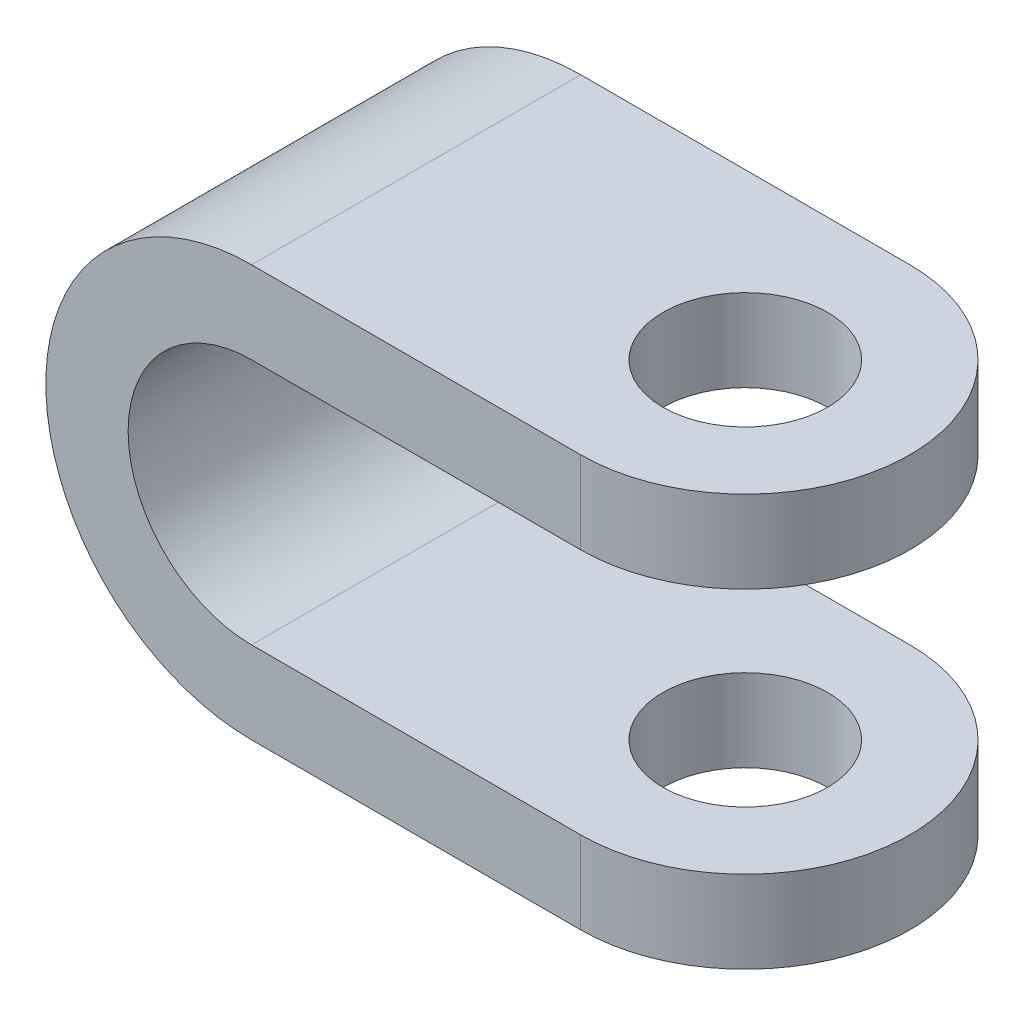
from build123d import *

# Parameters (mm, degrees)
EXTRUDE_THIN1_DEPTH = 90
SKETCH2_R           = 10
BOSS_EXTRUDE1_DEPTH = 90


with BuildPart() as part:
    # Sketch1 → Extrude-Thin1 (new body)
    with BuildSketch(Plane.XY):
        with BuildLine():
            Line((0, -15), (-60, -15))
            ThreePointArc((-60, -15), (-85, -40), (-60, -65))
            Line((-60, -65), (0, -65))
            Line((0, -65), (0, -55))
            Line((0, -55), (-60, -55))
            ThreePointArc((-60, -55), (-75, -40), (-60, -25))
            Line((-60, -25), (0, -25))
            Line((0, -25), (0, -15))
        make_face()
    extrude(amount=EXTRUDE_THIN1_DEPTH)


with BuildPart() as body_2:
    # Sketch2 → Boss-Extrude1 (new body)
    with BuildSketch(Plane(origin=(0, 0, 0), x_dir=(1, 0, 0), z_dir=(0, 1, 0))):
        with BuildLine():
            Line((-85, -25), (-85, -65))
            Line((-85, -65), (-20, -65))
            ThreePointArc((-20, -65), (0, -45), (-20, -25))
            Line((-20, -25), (-85, -25))
        make_face()
        with Locations((-20, -45)):
            Circle(SKETCH2_R, mode=Mode.SUBTRACT)
    extrude(amount=-BOSS_EXTRUDE1_DEPTH)


with BuildPart() as part_1:
    add(part.part)

    # Combine 1: intersect body 2
    add(body_2.part, mode=Mode.INTERSECT)


solid = part_1.part
